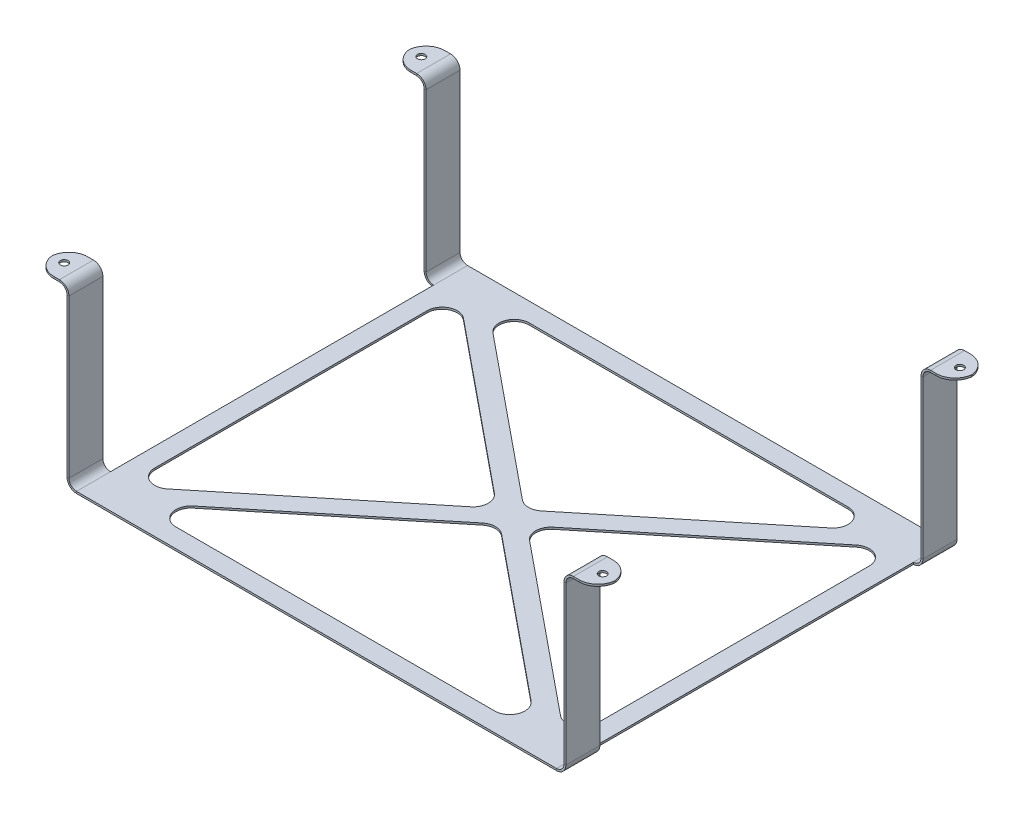
from build123d import *

# Parameters (mm, degrees)
BASE_FLANGE1_DEPTH           = 207
EDGE_FLANGE1_STRIP_W         = 12
EDGE_FLANGE1_STRIP_H         = 1
EDGE_FLANGE1_STRIP_CUT_DEPTH = 207
EDGE_FLANGE1_DEPTH           = 207
EDGE_FLANGE2_STRIP_W         = 12
EDGE_FLANGE2_STRIP_H         = 1
EDGE_FLANGE2_STRIP_CUT_DEPTH = 207
EDGE_FLANGE2_DEPTH           = 207
UNFOLD1_DEPTH                = 207
UNFOLD1_2_DEPTH              = 207
SKETCH15_W                   = 171
SKETCH15_H                   = 112.207963268
CUT_EXTRUDE2_DEPTH           = 425.023399195
FOLD2_DEPTH                  = 207
FOLD2_2_OUTLINE_W            = 254
FOLD2_2_OUTLINE_H            = 1
FOLD2_2_DEPTH                = 207
FOLD2_3_DEPTH                = 18
FOLD2_START                  = 189
FOLD2_4_DEPTH                = 18
CUT_EXTRUDE3_DEPTH           = 272.647289698
SKETCH19_R                   = 2.05
CUT_EXTRUDE4_DEPTH           = 272.647289698
FILLET2_R                    = 10


# Read off the part's stored shape, not the designer's step: Unfold1, Fold2
# Sheet-metal steps are written as plain solids
with BuildPart() as part:
    # Sketch1 → Base-Flange1 (new body)
    with BuildSketch(Plane.XY):
        with BuildLine():
            Line((-131, 92.5), (-131, 4))
            ThreePointArc((-131, 4), (-129.828427125, 1.171572875), (-127, 0))
            Line((-127, 0), (127, 0))
            ThreePointArc((127, 0), (129.828427125, 1.171572875), (131, 4))
            Line((131, 4), (131, 92.5))
            Line((131, 92.5), (132, 92.5))
            Line((132, 92.5), (132, 4))
            ThreePointArc((132, 4), (130.535533906, 0.464466094), (127, -1))
            Line((127, -1), (-127, -1))
            ThreePointArc((-127, -1), (-130.535533906, 0.464466094), (-132, 4))
            Line((-132, 4), (-132, 92.5))
            Line((-132, 92.5), (-131, 92.5))
        make_face()
    extrude(amount=BASE_FLANGE1_DEPTH)

    # Edge-Flange1 strip (across the edge) → Edge-Flange1 strip cut (cut)
    with BuildSketch(Plane(origin=(132, 92.5, 0), x_dir=(0, -1, 0), z_dir=(0, 0, 1))):
        with Locations((-1, -0.5)):
            Rectangle(EDGE_FLANGE1_STRIP_W, EDGE_FLANGE1_STRIP_H)
    extrude(amount=EDGE_FLANGE1_STRIP_CUT_DEPTH, mode=Mode.SUBTRACT)

    # Edge-Flange1 section (across the edge) → Edge-Flange1 (add)
    with BuildSketch(Plane(origin=(132, 92.5, 0), x_dir=(0, -1, 0), z_dir=(0, 0, 1))):
        with BuildLine():
            Line((0, 4), (0, 17))
            Line((0, 17), (1, 17))
            Line((1, 17), (1, 4))
            ThreePointArc((1, 4), (2.171572875, 1.171572875), (5, 0))
            Line((5, 0), (5, -1))
            ThreePointArc((5, -1), (1.464466094, 0.464466094), (0, 4))
        make_face()
    extrude(amount=EDGE_FLANGE1_DEPTH)

    # Edge-Flange2 strip (across the edge) → Edge-Flange2 strip cut (cut)
    with BuildSketch(Plane(origin=(-132, 92.5, 207), x_dir=(0, -1, 0), z_dir=(0, 0, -1))):
        with Locations((-1, -0.5)):
            Rectangle(EDGE_FLANGE2_STRIP_W, EDGE_FLANGE2_STRIP_H)
    extrude(amount=EDGE_FLANGE2_STRIP_CUT_DEPTH, mode=Mode.SUBTRACT)

    # Edge-Flange2 section (across the edge) → Edge-Flange2 (add)
    with BuildSketch(Plane(origin=(-132, 92.5, 207), x_dir=(0, -1, 0), z_dir=(0, 0, -1))):
        with BuildLine():
            Line((0, 4), (0, 17))
            Line((0, 17), (1, 17))
            Line((1, 17), (1, 4))
            ThreePointArc((1, 4), (2.171572875, 1.171572875), (5, 0))
            Line((5, 0), (5, -1))
            ThreePointArc((5, -1), (1.464466094, 0.464466094), (0, 4))
        make_face()
    extrude(amount=EDGE_FLANGE2_DEPTH)

    # Unfold1 outline → Unfold1 (cut)
    with BuildSketch(Plane.XY):
        with BuildLine():
            ThreePointArc((127, -1), (129.236067977, -0.472135955), (131, 1))
            Line((131, 1), (131, 4))
            ThreePointArc((131, 4), (129.828427125, 1.171572875), (127, 0))
            Line((127, 0), (-127, 0))
            ThreePointArc((-127, 0), (-129.828427125, 1.171572875), (-131, 4))
            Line((-131, 4), (-131, 87.5))
            ThreePointArc((-131, 87.5), (-132.464466094, 91.035533906), (-136, 92.5))
            Line((-136, 92.5), (-149, 92.5))
            Line((-149, 92.5), (-149, 91.5))
            Line((-149, 91.5), (-136, 91.5))
            ThreePointArc((-136, 91.5), (-133.171572875, 90.328427125), (-132, 87.5))
            Line((-132, 87.5), (-132, 4))
            ThreePointArc((-132, 4), (-130.535533906, 0.464466094), (-127, -1))
            Line((-127, -1), (127, -1))
        make_face()
        with BuildLine():
            ThreePointArc((136, 92.5), (133.763932023, 91.972135955), (132, 90.5))
            Line((132, 90.5), (132, 87.5))
            ThreePointArc((132, 87.5), (133.171572875, 90.328427125), (136, 91.5))
            Line((136, 91.5), (149, 91.5))
            Line((149, 91.5), (149, 92.5))
            Line((149, 92.5), (136, 92.5))
        make_face()
    extrude(amount=UNFOLD1_DEPTH, mode=Mode.SUBTRACT)

    # Unfold1 2 outline → Unfold1 2 (add)
    with BuildSketch(Plane.XY):
        with BuildLine():
            Line((131, 1), (131, -370.061944902))
            Line((131, -370.061944902), (132, -370.061944902))
            Line((132, -370.061944902), (132, 4))
            ThreePointArc((132, 4), (131.74341649, 2.41886117), (131, 1))
        make_face()
        with BuildLine():
            Line((131, 108.353981634), (131, 87.5))
            ThreePointArc((131, 87.5), (131.25658351, 89.08113883), (132, 90.5))
            Line((132, 90.5), (132, 108.353981634))
            Line((132, 108.353981634), (131, 108.353981634))
        make_face()
    extrude(amount=UNFOLD1_2_DEPTH)

    # Sketch15 → Cut-Extrude2 (cut, through all)
    with BuildSketch(Plane.ZY.offset(-131)):
        with Locations((103.5, 52.25)):
            Rectangle(SKETCH15_W, SKETCH15_H)
        with Locations((103.5, -313.957963268)):
            Rectangle(SKETCH15_W, SKETCH15_H)
    extrude(amount=-CUT_EXTRUDE2_DEPTH, mode=Mode.SUBTRACT)

    # Fold2 outline → Fold2 (cut)
    with BuildSketch(Plane.XY):
        with BuildLine():
            ThreePointArc((132, 4), (131.74341649, 2.41886117), (131, 1))
            Line((131, 1), (131, -370.061944902))
            Line((131, -370.061944902), (132, -370.061944902))
            Line((132, -370.061944902), (132, 4))
        make_face()
        with BuildLine():
            ThreePointArc((131, 87.5), (131.25658351, 89.08113883), (132, 90.5))
            Line((132, 90.5), (132, 108.353981634))
            Line((132, 108.353981634), (131, 108.353981634))
            Line((131, 108.353981634), (131, 87.5))
        make_face()
    extrude(amount=FOLD2_DEPTH, mode=Mode.SUBTRACT)



with BuildPart() as body_2:
    # Fold2 2 outline → Fold2 2 (new body)
    with BuildSketch(Plane.XY):
        with Locations((0, -0.5)):
            Rectangle(FOLD2_2_OUTLINE_W, FOLD2_2_OUTLINE_H)
    extrude(amount=FOLD2_2_DEPTH)


with BuildPart() as part_1:
    add(part.part)

    add(body_2.part)  # Fold2 3 merges body 2
    # Fold2 3 outline → Fold2 3 (add)
    with BuildSketch(Plane.XY):
        with BuildLine():
            ThreePointArc((131, 4), (129.828427125, 1.171572875), (127, 0))
            Line((127, 0), (127, -1))
            ThreePointArc((127, -1), (129.236067977, -0.472135955), (131, 1))
            Line((131, 1), (131, 4))
        make_face()
        with BuildLine():
            Line((-127, -1), (-127, 0))
            ThreePointArc((-127, 0), (-129.828427125, 1.171572875), (-131, 4))
            Line((-131, 4), (-131, 87.5))
            ThreePointArc((-131, 87.5), (-132.464466094, 91.035533906), (-136, 92.5))
            Line((-136, 92.5), (-149, 92.5))
            Line((-149, 92.5), (-149, 91.5))
            Line((-149, 91.5), (-136, 91.5))
            ThreePointArc((-136, 91.5), (-133.171572875, 90.328427125), (-132, 87.5))
            Line((-132, 87.5), (-132, 4))
            ThreePointArc((-132, 4), (-130.535533906, 0.464466094), (-127, -1))
        make_face()
        with BuildLine():
            ThreePointArc((132, 87.5), (133.171572875, 90.328427125), (136, 91.5))
            Line((136, 91.5), (149, 91.5))
            Line((149, 91.5), (149, 92.5))
            Line((149, 92.5), (136, 92.5))
            ThreePointArc((136, 92.5), (133.763932023, 91.972135955), (132, 90.5))
            Line((132, 90.5), (132, 87.5))
        make_face()
    extrude(amount=FOLD2_3_DEPTH)

    # Fold2 4 outline → Fold2 4 (add)
    with BuildSketch(Plane.XY.offset(FOLD2_START)):
        with BuildLine():
            ThreePointArc((131, 4), (129.828427125, 1.171572875), (127, 0))
            Line((127, 0), (127, -1))
            ThreePointArc((127, -1), (129.236067977, -0.472135955), (131, 1))
            Line((131, 1), (131, 4))
        make_face()
        with BuildLine():
            Line((-127, -1), (-127, 0))
            ThreePointArc((-127, 0), (-129.828427125, 1.171572875), (-131, 4))
            Line((-131, 4), (-131, 87.5))
            ThreePointArc((-131, 87.5), (-132.464466094, 91.035533906), (-136, 92.5))
            Line((-136, 92.5), (-149, 92.5))
            Line((-149, 92.5), (-149, 91.5))
            Line((-149, 91.5), (-136, 91.5))
            ThreePointArc((-136, 91.5), (-133.171572875, 90.328427125), (-132, 87.5))
            Line((-132, 87.5), (-132, 4))
            ThreePointArc((-132, 4), (-130.535533906, 0.464466094), (-127, -1))
        make_face()
        with BuildLine():
            ThreePointArc((132, 87.5), (133.171572875, 90.328427125), (136, 91.5))
            Line((136, 91.5), (149, 91.5))
            Line((149, 91.5), (149, 92.5))
            Line((149, 92.5), (136, 92.5))
            ThreePointArc((136, 92.5), (133.763932023, 91.972135955), (132, 90.5))
            Line((132, 90.5), (132, 87.5))
        make_face()
    extrude(amount=FOLD2_4_DEPTH)

    # Sketch18 → Cut-Extrude3 (cut, through all)
    with BuildSketch(Plane.XZ.offset(1)):
        with BuildLine():
            Line((-103.946072958, 181.761839212), (-15.524130205, 109.701437047))
            ThreePointArc((-15.524130205, 109.701437047), (-12.578057247, 103.5), (-15.524130205, 97.298562953))
            Line((-15.524130205, 97.298562953), (-103.946072958, 25.238160788))
            ThreePointArc((-103.946072958, 25.238160788), (-112.432825634, 24.213554093), (-117, 31.439597835))
            Line((-117, 31.439597835), (-117, 175.560402165))
            ThreePointArc((-117, 175.560402165), (-112.432825634, 182.786445907), (-103.946072958, 181.761839212))
        make_face()
        with BuildLine():
            ThreePointArc((-89.388913274, 182.798562953), (-91.871945047, 191.682210247), (-84.334986231, 197))
            Line((-84.334986231, 197), (84.334986231, 197))
            ThreePointArc((84.334986231, 197), (91.871945047, 191.682210247), (89.388913274, 182.798562953))
            Line((89.388913274, 182.798562953), (5.053927042, 114.068869449))
            ThreePointArc((5.053927042, 114.068869449), (0, 112.270306496), (-5.053927042, 114.068869449))
            Line((-5.053927042, 114.068869449), (-89.388913274, 182.798562953))
        make_face()
        with BuildLine():
            ThreePointArc((103.946072958, 181.761839212), (112.432825634, 182.786445907), (117, 175.560402165))
            Line((117, 175.560402165), (117, 31.439597835))
            ThreePointArc((117, 31.439597835), (112.432825634, 24.213554093), (103.946072958, 25.238160788))
            Line((103.946072958, 25.238160788), (15.524130205, 97.298562953))
            ThreePointArc((15.524130205, 97.298562953), (12.578057247, 103.5), (15.524130205, 109.701437047))
            Line((15.524130205, 109.701437047), (103.946072958, 181.761839212))
        make_face()
        with BuildLine():
            Line((5.053927042, 92.931130551), (89.388913274, 24.201437047))
            ThreePointArc((89.388913274, 24.201437047), (91.871945047, 15.317789753), (84.334986231, 10))
            Line((84.334986231, 10), (-84.334986231, 10))
            ThreePointArc((-84.334986231, 10), (-91.871945047, 15.317789753), (-89.388913274, 24.201437047))
            Line((-89.388913274, 24.201437047), (-5.053927042, 92.931130551))
            ThreePointArc((-5.053927042, 92.931130551), (0, 94.729693504), (5.053927042, 92.931130551))
        make_face()
    extrude(amount=-CUT_EXTRUDE3_DEPTH, mode=Mode.SUBTRACT)

    # Sketch19 → Cut-Extrude4 (cut, through all)
    with BuildSketch(Plane(origin=(0, 92.5, 0), x_dir=(1, 0, 0), z_dir=(0, 1, 0))):
        with Locations(Location((142.5, -198, 0), (0, 0, 180))):
            Circle(SKETCH19_R)
        with Locations(Location((-142.5, -9, 0), (0, 0, 180))):
            Circle(SKETCH19_R)
        with Locations((-142.5, -198)):
            Circle(SKETCH19_R)
        with Locations(Location((142.5, -9, 0), (0, 0, 180))):
            Circle(SKETCH19_R)
    extrude(amount=-CUT_EXTRUDE4_DEPTH, mode=Mode.SUBTRACT)

    # Fillet2
    # the kernel refuses this fillet: 10 mm, written as the material it takes off along each edge
    with BuildSketch(Plane(origin=(149, 66.5, 0), x_dir=(-1, 0, 0), z_dir=(0, 1, 0)), Plane(origin=(149, 66.5, 189), x_dir=(-1, 0, 0), z_dir=(0, 1, 0)), Plane(origin=(-149, 117.5, 189), x_dir=(1, 0, 0), z_dir=(0, -1, 0)), Plane(origin=(-149, 117.5, 0), x_dir=(1, 0, 0), z_dir=(0, -1, 0)), Plane(origin=(-149, 117.5, 18), x_dir=(0, 0, -1), z_dir=(0, -1, 0))) as fillet2_piece_1:
        with BuildLine():
            CenterArc((FILLET2_R, FILLET2_R), FILLET2_R, 180, 90)
            Line((0, FILLET2_R), (0, 0))
            Line((0, 0), (FILLET2_R, 0))
        make_face()
    extrude(amount=51, mode=Mode.SUBTRACT)
    with BuildSketch(Plane(origin=(149, 66.5, 18), x_dir=(-1, 0, 0), z_dir=(0, 1, 0)), Plane(origin=(149, 66.5, 207), x_dir=(-1, 0, 0), z_dir=(0, 1, 0)), Plane(origin=(-149, 117.5, 207), x_dir=(1, 0, 0), z_dir=(0, -1, 0))) as fillet2_piece_2:
        with BuildLine():
            CenterArc((FILLET2_R, -FILLET2_R), FILLET2_R, 90, 90)
            Line((0, -FILLET2_R), (0, 0))
            Line((0, 0), (FILLET2_R, 0))
        make_face()
    extrude(amount=51, mode=Mode.SUBTRACT)


solid = part_1.part
